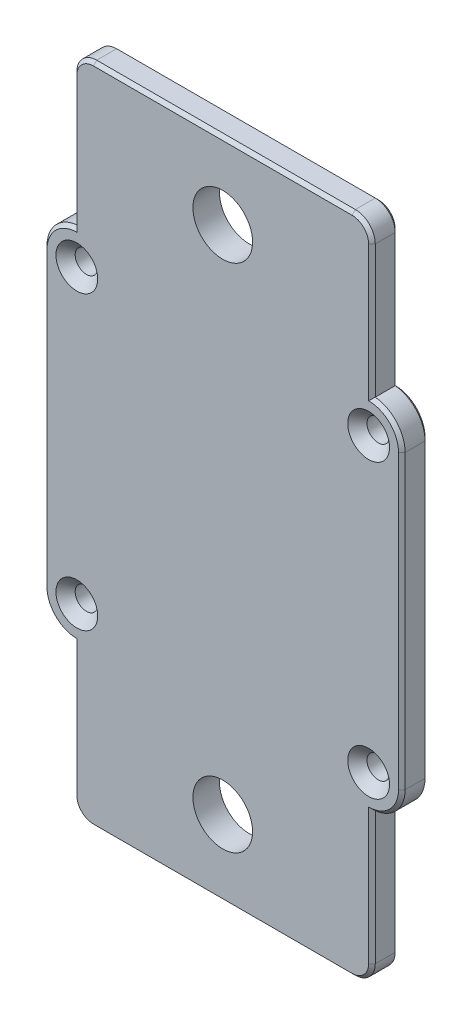
from build123d import *

# Parameters (mm, degrees)
BOSS_EXTRU_1_DEPTH                             = 4
FRAISAGE_POUR_VIS_T_TE_FRAIS_E_M31_D           = 3.4
FRAISAGE_POUR_VIS_T_TE_FRAIS_E_M31_CSINK_D     = 6.3
FRAISAGE_POUR_VIS_T_TE_FRAIS_E_M31_CSINK_ANGLE = 90
CONG_1_R                                       = 5
D_GAGEMENT_M81_D                               = 9
CONG_2_R                                       = 3
CHANFREIN1_SIZE                                = 0.5
CHANFREIN2_SIZE                                = 0.5


with BuildPart() as part:
    # Esquisse1 → Boss.-Extru.1 (new body)
    with BuildSketch(Plane.XY):
        Polygon((0, 77), (4.5, 77), (4.5, 23), (0, 23), (0, 0), (-45, 0), (-45, 23), (-49.5, 23), (-49.5, 77), (-45, 77), (-45, 100), (0, 100), align=None)
    extrude(amount=BOSS_EXTRU_1_DEPTH)

    # Fraisage pour vis à tête fraisée M31 (through all)
    with Locations(Plane.XY.offset(4)):
        with Locations((-44.5, 72), (-0.5, 72), (-0.5, 28), (-44.5, 28)):
            CounterSinkHole(FRAISAGE_POUR_VIS_T_TE_FRAIS_E_M31_D / 2, FRAISAGE_POUR_VIS_T_TE_FRAIS_E_M31_CSINK_D / 2, counter_sink_angle=FRAISAGE_POUR_VIS_T_TE_FRAIS_E_M31_CSINK_ANGLE)

    # Congé1
    # the kernel refuses this fillet: 5 mm, written as the material it takes off along each edge
    with BuildSketch(Plane(origin=(-49.5, 23, -12.437342964), x_dir=(0, 1, 0), z_dir=(0, 0, 1))) as cong_1_piece_1:
        with BuildLine():
            CenterArc((4.974937186, -5), CONG_1_R, 90, 84.260829523)
            Line((0, -4.5), (-0.099498744, -4.49))
            ThreePointArc((-0.099498744, -4.49), (-0.1, -2.25), (-0.1, 0))
            Line((-0.1, 0), (0, 0.1))
            Line((0, 0.1), (4.974937186, 0.1))
            Line((4.974937186, 0.1), (4.974937186, 0))
        make_face()
    extrude(amount=28.874685928, mode=Mode.SUBTRACT)
    with BuildSketch(Plane(origin=(-49.5, 77, -12.437342964), x_dir=(1, 0, 0), z_dir=(0, 0, 1)), Plane(origin=(4.5, 23, -12.437342964), x_dir=(-1, 0, 0), z_dir=(0, 0, 1))) as cong_1_piece_2:
        with BuildLine():
            CenterArc((5, -4.974937186), CONG_1_R, 95.739170477, 84.260829523)
            Line((0, -4.974937186), (-0.1, -4.974937186))
            Line((-0.1, -4.974937186), (-0.1, 0))
            Line((-0.1, 0), (0, 0.1))
            ThreePointArc((0, 0.1), (2.25, 0.1), (4.49, 0.099498744))
            Line((4.49, 0.099498744), (4.5, 0))
        make_face()
    extrude(amount=28.874685928, mode=Mode.SUBTRACT)
    with BuildSketch(Plane(origin=(4.5, 77, -12.437342964), x_dir=(-1, 0, 0), z_dir=(0, 0, 1))) as cong_1_piece_3:
        with BuildLine():
            CenterArc((5, 4.974937186), CONG_1_R, 180, 84.260829523)
            Line((0, 4.974937186), (-0.1, 4.974937186))
            Line((-0.1, 4.974937186), (-0.1, 0))
            Line((-0.1, 0), (0, -0.1))
            ThreePointArc((0, -0.1), (2.25, -0.1), (4.49, -0.099498744))
            Line((4.49, -0.099498744), (4.5, 0))
        make_face()
    extrude(amount=28.874685928, mode=Mode.SUBTRACT)

    # Dégagement M81 (through all)
    with Locations(Plane.XY.offset(4)):
        with Locations((-22.5, 88.5), (-22.5, 11.5)):
            Hole(D_GAGEMENT_M81_D / 2)

    # Congé2
    cong_2_edges = [part.edges().sort_by_distance(p)[0] for p in [
        (-45, 100, 2),
        (0, 100, 2),
        (0, 0, 2),
        (-45, 0, 2),
    ]]
    fillet(cong_2_edges, radius=CONG_2_R)

    # Chanfrein1
    chanfrein1_edges = [part.edges().sort_by_distance(p)[0] for p in [
        (0, 87, 0),
        (-45, 13, 0),
        (-49.5, 50, 0),
        (4.5, 50, 0),
        (3.208099244, 24.620835219, 0),
        (-48.208099244, 75.379164781, 0),
        (-48.208099244, 24.620835219, 0),
        (3.208099244, 75.379164781, 0),
        (4.5, 50, 4),
        (3.208099244, 24.620835219, 4),
        (3.208099244, 75.379164781, 4),
        (0, 13, 0),
        (-22.5, 0, 0),
        (-45, 87, 0),
        (-22.5, 100, 0),
        (-0.878679656, 99.121320344, 0),
        (-44.121320344, 99.121320344, 0),
        (-44.121320344, 0.878679656, 0),
        (-0.878679656, 0.878679656, 0),
    ]]
    chamfer(chanfrein1_edges, length=CHANFREIN1_SIZE)

    # Chanfrein2
    chanfrein2_edges = [part.edges().sort_by_distance(p)[0] for p in [
        (0, 86.748599385, 4),
        (-0.878679656, 99.121320344, 4),
        (-22.5, 100, 4),
        (-44.121320344, 99.121320344, 4),
        (-45, 87, 4),
        (-45, 13, 4),
        (-44.121320344, 0.878679656, 4),
        (-22.5, 0, 4),
        (-0.878679656, 0.878679656, 4),
        (0, 13.251400615, 4),
        (-48.208099244, 75.379164781, 4),
        (-48.208099244, 24.620835219, 4),
        (-49.5, 50, 4),
    ]]
    chamfer(chanfrein2_edges, length=CHANFREIN2_SIZE)


solid = part.part
